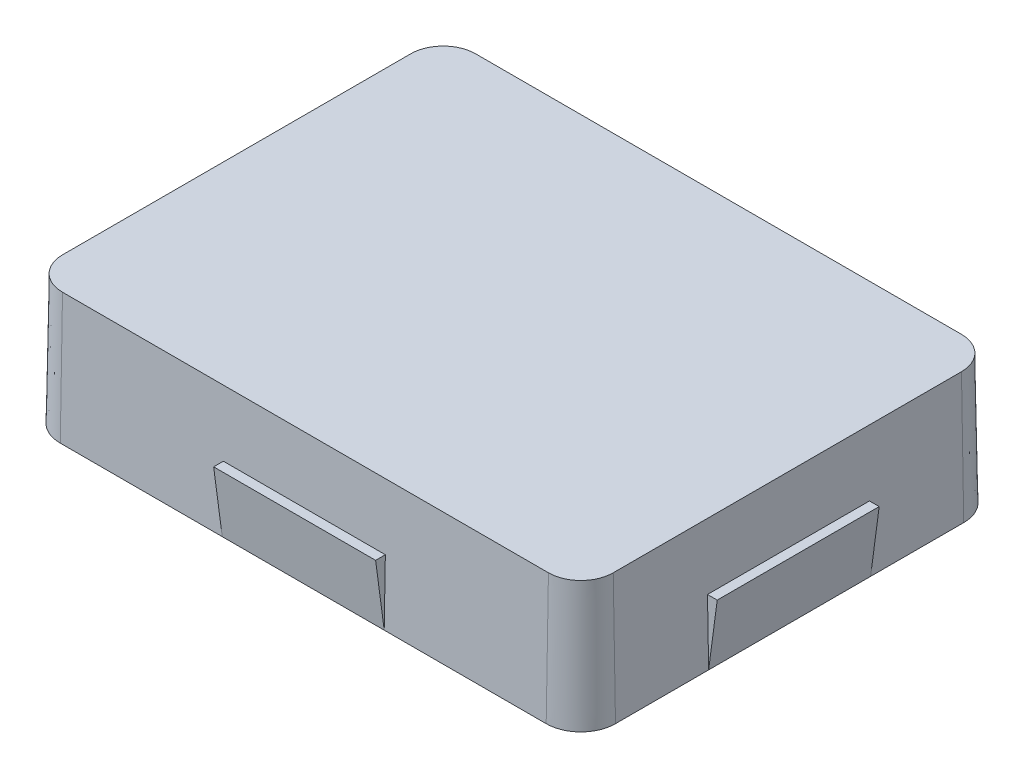
from build123d import *

# Parameters (mm, degrees)
BOSS_EXTRUDE1_DEPTH = 4
BOSS_EXTRUDE1_DRAFT = 1
SHELL1_T            = -0.5
SKETCH2_R           = 2
BOSS_EXTRUDE2_DEPTH = 5.5
BOSS_EXTRUDE2_TAPER = 1.5
SKETCH4_R           = 1.605977431
CUT_EXTRUDE1_DEPTH  = 5.5
CUT_EXTRUDE1_DRAFT  = 1.5
BOSS_EXTRUDE3_DEPTH = 2.5
BOSS_EXTRUDE4_DEPTH = 2.5


with BuildPart() as part:
    # Sketch1 → Boss-Extrude1 (with draft: the straight prism first)
    with BuildSketch(Plane(origin=(0, 0, 0), x_dir=(1, 0, 0), z_dir=(0, 1, 0))):
        with BuildLine():
            Line((-7.5, -6.375), (7.5, -6.375))
            ThreePointArc((7.5, -6.375), (8.207106781, -6.082106781), (8.5, -5.375))
            Line((8.5, -5.375), (8.5, 5.375))
            ThreePointArc((8.5, 5.375), (8.207106781, 6.082106781), (7.5, 6.375))
            Line((7.5, 6.375), (-7.5, 6.375))
            ThreePointArc((-7.5, 6.375), (-8.207106781, 6.082106781), (-8.5, 5.375))
            Line((-8.5, 5.375), (-8.5, -5.375))
            ThreePointArc((-8.5, -5.375), (-8.207106781, -6.082106781), (-7.5, -6.375))
        make_face()
    extrude(amount=-BOSS_EXTRUDE1_DEPTH)
    # Boss-Extrude1: the draft: its side faces are tilted about the plane it starts from
    boss_extrude1_sides = [part.faces().sort_by_distance(p)[0] for p in [
        (0, -2, 6.375),
        (8.207106781, -2, 6.082106781),
        (8.5, -2, 0),
        (8.207106781, -2, -6.082106781),
        (0, -2, -6.375),
        (-8.207106781, -2, -6.082106781),
        (-8.5, -2, 0),
        (-8.207106781, -2, 6.082106781),
    ]]
    draft(boss_extrude1_sides, Plane(origin=(0, 0, 0), x_dir=(1, 0, 0), z_dir=(0, 1, 0)), BOSS_EXTRUDE1_DRAFT)

    # Shell1
    shell1_openings = [part.faces().sort_by_distance(p)[0] for p in [
        (0, -4, 0),
    ]]
    offset(amount=SHELL1_T, openings=shell1_openings, kind=Kind.INTERSECTION)

    # Sketch2 → Boss-Extrude2 (add)
    with BuildSketch(Plane.XZ.offset(0.5)):
        Circle(SKETCH2_R)
    extrude(amount=BOSS_EXTRUDE2_DEPTH, taper=BOSS_EXTRUDE2_TAPER)

    # Rib1: read off the stored shape, not the designer's step
    # Rib1: loft between two sections, ruled curve by curve
    rib1_from = [
        Edge.make_line((1.982008604, -0.5, 0.267660037), (3, -0.5, 0.25)),
        Edge.make_line((1.982008604, -0.5, -0.267660037), (3, -0.5, -0.25)),
        Edge.make_line((3, -0.5, -0.25), (3, -0.5, 0.25)),
        Edge.make_line((1.982008604, -0.5, -0.267660037), (1.982008604, -0.5, 0.267660037)),
    ]
    rib1_to = [
        Edge.make_line((1.83774048, -6, 0.259542201), (2.387789079, -6, 0.25)),
        Edge.make_line((1.83774048, -6, -0.259542201), (2.387789079, -6, -0.25)),
        Edge.make_line((2.387789079, -6, -0.25), (2.387789079, -6, 0.25)),
        Edge.make_line((1.83774048, -6, -0.259542201), (1.83774048, -6, 0.259542201)),
    ]
    rib1 = Solid(Shell([*[Face.make_surface_from_curves(rib1_from[k], rib1_to[k]) for k in range(4)], Face(Wire(rib1_from)), Face(Wire(rib1_to))]))
    add(rib1)

    # CirPattern1: read off the stored shape, not the designer's step
    # CirPattern1: loft between two sections, ruled curve by curve
    cirpattern1_from = [
        Edge.make_line((-0.267660037, -0.5, 1.982008604), (-0.25, -0.5, 3)),
        Edge.make_line((0.267660037, -0.5, 1.982008604), (0.25, -0.5, 3)),
        Edge.make_line((0.25, -0.5, 3), (-0.25, -0.5, 3)),
        Edge.make_line((0.267660037, -0.5, 1.982008604), (-0.267660037, -0.5, 1.982008604)),
    ]
    cirpattern1_to = [
        Edge.make_line((-0.259542201, -6, 1.83774048), (-0.25, -6, 2.387789079)),
        Edge.make_line((0.259542201, -6, 1.83774048), (0.25, -6, 2.387789079)),
        Edge.make_line((0.25, -6, 2.387789079), (-0.25, -6, 2.387789079)),
        Edge.make_line((0.259542201, -6, 1.83774048), (-0.259542201, -6, 1.83774048)),
    ]
    cirpattern1 = Solid(Shell([*[Face.make_surface_from_curves(cirpattern1_from[k], cirpattern1_to[k]) for k in range(4)], Face(Wire(cirpattern1_from)), Face(Wire(cirpattern1_to))]))
    add(cirpattern1)

    # CirPattern1 2: loft between two sections, ruled curve by curve
    cirpattern1_2_from = [
        Edge.make_line((-1.982008604, -0.5, -0.267660037), (-3, -0.5, -0.25)),
        Edge.make_line((-1.982008604, -0.5, 0.267660037), (-3, -0.5, 0.25)),
        Edge.make_line((-3, -0.5, 0.25), (-3, -0.5, -0.25)),
        Edge.make_line((-1.982008604, -0.5, 0.267660037), (-1.982008604, -0.5, -0.267660037)),
    ]
    cirpattern1_2_to = [
        Edge.make_line((-1.83774048, -6, -0.259542201), (-2.387789079, -6, -0.25)),
        Edge.make_line((-1.83774048, -6, 0.259542201), (-2.387789079, -6, 0.25)),
        Edge.make_line((-2.387789079, -6, 0.25), (-2.387789079, -6, -0.25)),
        Edge.make_line((-1.83774048, -6, 0.259542201), (-1.83774048, -6, -0.259542201)),
    ]
    cirpattern1_2 = Solid(Shell([*[Face.make_surface_from_curves(cirpattern1_2_from[k], cirpattern1_2_to[k]) for k in range(4)], Face(Wire(cirpattern1_2_from)), Face(Wire(cirpattern1_2_to))]))
    add(cirpattern1_2)

    # CirPattern1 3: loft between two sections, ruled curve by curve
    cirpattern1_3_from = [
        Edge.make_line((0.267660037, -0.5, -1.982008604), (0.25, -0.5, -3)),
        Edge.make_line((-0.267660037, -0.5, -1.982008604), (-0.25, -0.5, -3)),
        Edge.make_line((-0.25, -0.5, -3), (0.25, -0.5, -3)),
        Edge.make_line((-0.267660037, -0.5, -1.982008604), (0.267660037, -0.5, -1.982008604)),
    ]
    cirpattern1_3_to = [
        Edge.make_line((0.259542201, -6, -1.83774048), (0.25, -6, -2.387789079)),
        Edge.make_line((-0.259542201, -6, -1.83774048), (-0.25, -6, -2.387789079)),
        Edge.make_line((-0.25, -6, -2.387789079), (0.25, -6, -2.387789079)),
        Edge.make_line((-0.259542201, -6, -1.83774048), (0.259542201, -6, -1.83774048)),
    ]
    cirpattern1_3 = Solid(Shell([*[Face.make_surface_from_curves(cirpattern1_3_from[k], cirpattern1_3_to[k]) for k in range(4)], Face(Wire(cirpattern1_3_from)), Face(Wire(cirpattern1_3_to))]))
    add(cirpattern1_3)


with BuildPart() as cut_extrude1_tool:
    # Sketch4 → Cut-Extrude1 (with draft: the straight prism first)
    with BuildSketch(Plane.XZ.offset(6)):
        Circle(SKETCH4_R)
    extrude(amount=-CUT_EXTRUDE1_DEPTH)
    # Cut-Extrude1: the draft: its side faces are tilted about the plane it starts from
    cut_extrude1_sides = [cut_extrude1_tool.faces().sort_by_distance(p)[0] for p in [
        (-1.605977431, -3.25, 0),
    ]]
    draft(cut_extrude1_sides, Plane.XZ.offset(6), CUT_EXTRUDE1_DRAFT)


with BuildPart() as part_1:
    add(part.part)

    # Cut-Extrude1: cut by cut_extrude1_tool
    add(cut_extrude1_tool.part, mode=Mode.SUBTRACT)

    # Sketch5 → Boss-Extrude3 (add, symmetric)
    with BuildSketch(Plane(origin=(0, 0, 0), x_dir=(0, 0, -1), z_dir=(1, 0, 0))):
        Polygon((6.44482026, -4), (6.40991013, -2), (6.70991013, -2), align=None)
        Polygon((-6.70991013, -2), (-6.44482026, -4), (-6.40991013, -2), align=None)
    extrude(amount=BOSS_EXTRUDE3_DEPTH, both=True)

    # Sketch6 → Boss-Extrude4 (add, symmetric)
    with BuildSketch(Plane.XY):
        Polygon((8.56982026, -4), (8.53491013, -2), (8.83491013, -2), align=None)
        Polygon((-8.83491013, -2), (-8.56982026, -4), (-8.53491013, -2), align=None)
    extrude(amount=BOSS_EXTRUDE4_DEPTH, both=True)


solid = part_1.part
